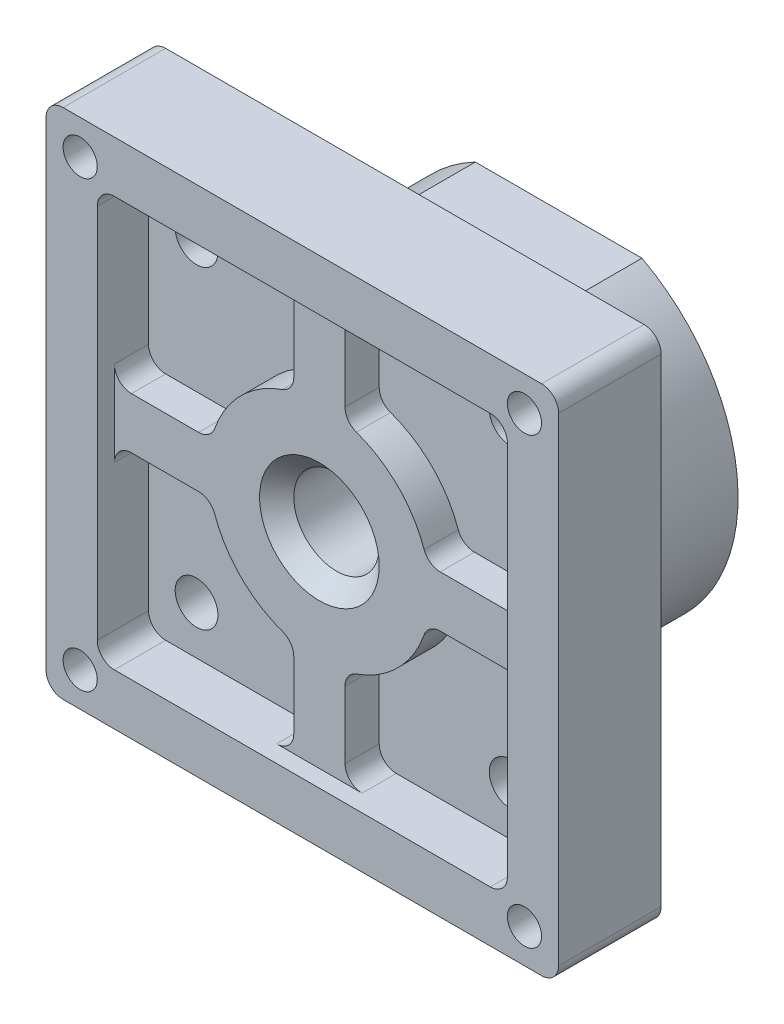
from build123d import *

# Parameters (mm, degrees)
SKETCH2_W              = 30
SKETCH2_H              = 30
BOSS_EXTRUDE1_DEPTH    = 6
CUT_EXTRUDE1_START     = -1
CUT_EXTRUDE1_OUTLINE_W = 24
CUT_EXTRUDE1_OUTLINE_H = 24
CUT_EXTRUDE1_DEPTH     = 1
SKETCH4_W              = 24
SKETCH4_H              = 24
SKETCH4_R              = 6.5
CUT_EXTRUDE2_DEPTH     = 2
SKETCH5_W              = 3
SKETCH5_H              = 24
BOSS_EXTRUDE2_DEPTH    = 2
SKETCH6_W              = 24
SKETCH6_H              = 3
BOSS_EXTRUDE3_DEPTH    = 2
FILLET1_R              = 1
FILLET2_R              = 1
SKETCH8_R              = 1.25
CUT_EXTRUDE3_DEPTH     = 10
SKETCH7_R              = 1.25
CUT_EXTRUDE4_DEPTH     = 6
FILLET3_R              = 1
SKETCH10_R             = 10.5
BOSS_EXTRUDE4_DEPTH    = 9
SKETCH11_R             = 9
CUT_EXTRUDE5_DEPTH     = 3
SKETCH9_R              = 2.5
CUT_EXTRUDE6_DEPTH     = 26.416530054
SKETCH12_R             = 1
CUT_EXTRUDE7_DEPTH     = 13
SKETCH13_W             = 15.514513233
SKETCH13_H             = 2.095553254
CUT_EXTRUDE9_DEPTH     = 7
CHAMFER1_SIZE          = 1


# Read off the part's stored shape, not the designer's step: Cut-Extrude1
with BuildPart() as part:
    # Sketch2 → Boss-Extrude1 (new body)
    with BuildSketch(Plane.XY):
        Rectangle(SKETCH2_W, SKETCH2_H)
    extrude(amount=BOSS_EXTRUDE1_DEPTH)

    # Cut-Extrude1 outline → Cut-Extrude1 (cut)
    with BuildSketch(Plane.XY.offset(6).offset(CUT_EXTRUDE1_START)):
        Rectangle(CUT_EXTRUDE1_OUTLINE_W, CUT_EXTRUDE1_OUTLINE_H)
    extrude(amount=CUT_EXTRUDE1_DEPTH, mode=Mode.SUBTRACT)

    # Sketch4 → Cut-Extrude2 (cut)
    with BuildSketch(Plane.XY.offset(5)):
        Rectangle(SKETCH4_W, SKETCH4_H)
        Circle(SKETCH4_R, mode=Mode.SUBTRACT)
    extrude(amount=-CUT_EXTRUDE2_DEPTH, mode=Mode.SUBTRACT)

    # Sketch5 → Boss-Extrude2 (add)
    with BuildSketch(Plane.XY.offset(5)):
        Rectangle(SKETCH5_W, SKETCH5_H)
    extrude(amount=-BOSS_EXTRUDE2_DEPTH)

    # Sketch6 → Boss-Extrude3 (add)
    with BuildSketch(Plane.XY.offset(5)):
        Rectangle(SKETCH6_W, SKETCH6_H)
    extrude(amount=-BOSS_EXTRUDE3_DEPTH)

    # Fillet1
    fillet1_edges = [part.edges().sort_by_distance(p)[0] for p in [
        (1.5, 6.32455532, 4),
        (-1.5, -6.32455532, 4),
        (1.5, -6.32455532, 4),
        (-1.5, 6.32455532, 4),
        (6.32455532, -1.5, 4),
        (6.32455532, 1.5, 4),
        (-6.32455532, -1.5, 4),
        (-6.32455532, 1.5, 4),
    ]]
    fillet(fillet1_edges, radius=FILLET1_R)

    # Fillet2
    fillet2_edges = [part.edges().sort_by_distance(p)[0] for p in [
        (12, 12, 4.5),
        (12, -12, 4.5),
        (-12, -12, 4.5),
        (-12, 12, 4.5),
        (1.5, 12, 4),
        (-1.5, -12, 4),
        (1.5, -12, 4),
        (-1.5, 12, 4),
        (12, -1.5, 4),
        (12, 1.5, 4),
        (-12, -1.5, 4),
        (-12, 1.5, 4),
    ]]
    fillet(fillet2_edges, radius=FILLET2_R)

    # Sketch8 → Cut-Extrude3 (cut)
    with BuildSketch(Plane.XY.offset(3)):
        with Locations((-9.19, -9.19)):
            Circle(SKETCH8_R)
        with Locations((9.19, -9.19)):
            Circle(SKETCH8_R)
    extrude(amount=-CUT_EXTRUDE3_DEPTH, mode=Mode.SUBTRACT)

    # Sketch7 → Cut-Extrude4 (cut)
    with BuildSketch(Plane.XY.offset(6)):
        with Locations((-9.19, 9.19)):
            Circle(SKETCH7_R)
        with Locations((9.19, 9.19)):
            Circle(SKETCH7_R)
    extrude(amount=-CUT_EXTRUDE4_DEPTH, mode=Mode.SUBTRACT)

    # Fillet3
    fillet3_edges = [part.edges().sort_by_distance(p)[0] for p in [
        (15, -15, 3),
        (-15, -15, 3),
        (-15, 15, 3),
        (15, 15, 3),
    ]]
    fillet(fillet3_edges, radius=FILLET3_R)

    # Sketch10 → Boss-Extrude4 (add)
    with BuildSketch(Plane(origin=(0, 0, 0), x_dir=(-1, 0, 0), z_dir=(0, 0, -1))):
        Circle(SKETCH10_R)
    extrude(amount=BOSS_EXTRUDE4_DEPTH)

    # Sketch11 → Cut-Extrude5 (cut)
    with BuildSketch(Plane(origin=(0, 0, -9), x_dir=(-1, 0, 0), z_dir=(0, 0, -1))):
        Circle(SKETCH11_R)
    extrude(amount=-CUT_EXTRUDE5_DEPTH, mode=Mode.SUBTRACT)

    # Sketch9 → Cut-Extrude6 (cut, through all)
    with BuildSketch(Plane.XY.offset(5)):
        Circle(SKETCH9_R)
    extrude(amount=-CUT_EXTRUDE6_DEPTH, mode=Mode.SUBTRACT)

    # Sketch12 → Cut-Extrude7 (cut)
    with BuildSketch(Plane(origin=(0, 0, 0), x_dir=(-1, 0, 0), z_dir=(0, 0, -1))):
        with Locations((13, 13)):
            Circle(SKETCH12_R)
        with Locations((-13, 13)):
            Circle(SKETCH12_R)
        with Locations((-13, -13)):
            Circle(SKETCH12_R)
        with Locations((13, -13)):
            Circle(SKETCH12_R)
    extrude(amount=-CUT_EXTRUDE7_DEPTH, mode=Mode.SUBTRACT)

    # Sketch13 → Cut-Extrude9 (cut)
    with BuildSketch(Plane(origin=(0, 0, -9), x_dir=(-1, 0, 0), z_dir=(0, 0, -1))):
        with Locations((1.781437306, 10.347776627)):
            Rectangle(SKETCH13_W, SKETCH13_H)
    extrude(amount=-CUT_EXTRUDE9_DEPTH, mode=Mode.SUBTRACT)

    # Chamfer1
    chamfer1_edges = [part.edges().sort_by_distance(p)[0] for p in [
        (-2.5, 0, 5),
    ]]
    chamfer(chamfer1_edges, length=CHAMFER1_SIZE)


solid = part.part
